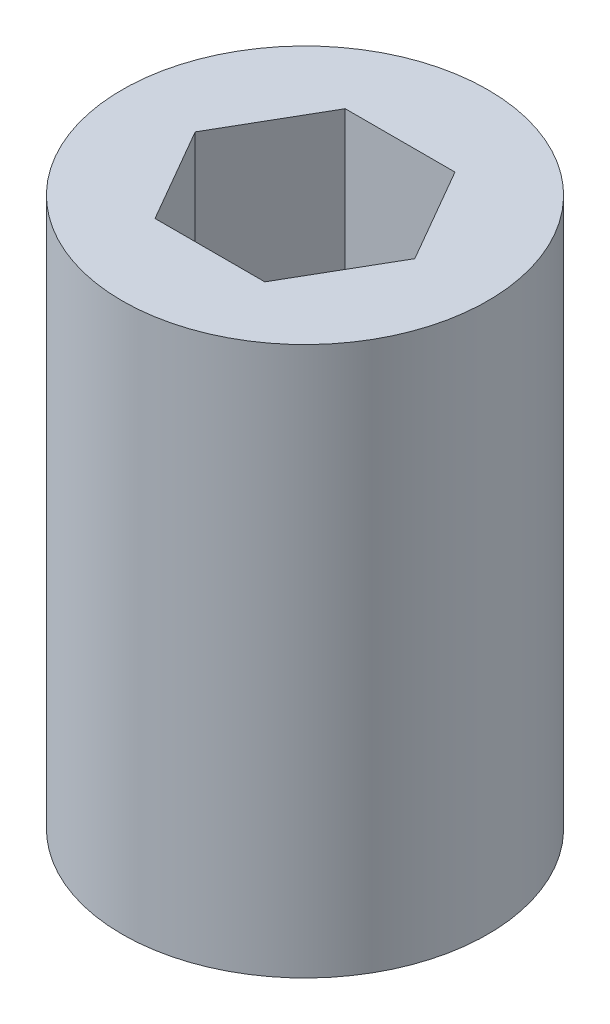
from build123d import *

# Parameters (mm, degrees)
SKETCH1_R           = 12.7
BOSS_EXTRUDE1_DEPTH = 38.1
CUT_EXTRUDE1_DEPTH  = 43.121134838


with BuildPart() as part:
    # Sketch1 → Boss-Extrude1 (new body)
    with BuildSketch(Plane(origin=(0, 0, 0), x_dir=(1, 0, 0), z_dir=(0, 1, 0))):
        Circle(SKETCH1_R)
    extrude(amount=BOSS_EXTRUDE1_DEPTH)

    # Sketch5 → Cut-Extrude1 (cut, through all)
    with BuildSketch(Plane(origin=(0, 0, 0), x_dir=(-1, 0, 0), z_dir=(0, -1, 0))):
        Polygon((-7.625642355, 0), (-3.812821178, -6.604), (3.812821178, -6.604), (7.625642355, 0), (3.812821178, 6.604), (-3.812821178, 6.604), align=None)
    extrude(amount=-CUT_EXTRUDE1_DEPTH, mode=Mode.SUBTRACT)


solid = part.part
